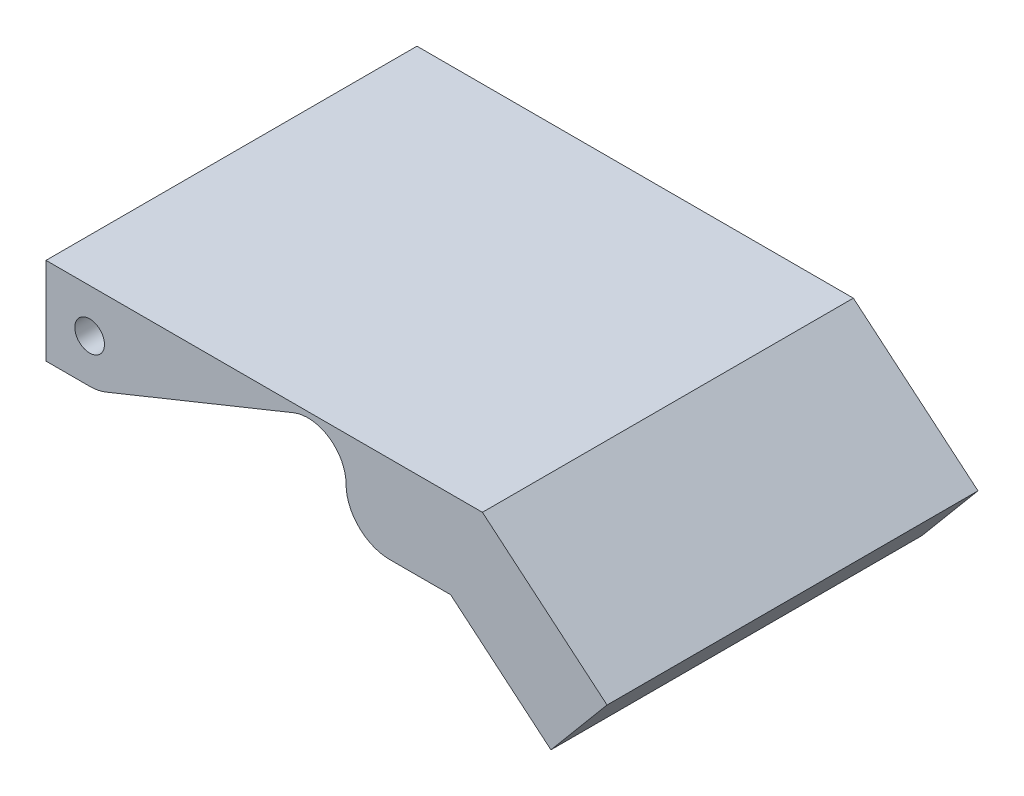
from build123d import *

# Parameters (mm, degrees)
BOSS_EXTRUDE1_DEPTH = 26.9875
SKETCH2_R           = 2.159
SKETCH2_R_2         = 1.905
CUT_EXTRUDE1_DEPTH  = 101.993512556
CUT_EXTRUDE2_DEPTH  = 12.7


with BuildPart() as part:
    # Sketch1 → Boss-Extrude1 (new, symmetric)
    with BuildSketch(Plane.XY):
        Polygon((0, 0), (63.5, 0), (81.634127309, -15.216339537), (73.470724666, -24.945103965), (58.877578025, -12.7), (0, -12.7), align=None)
    extrude(amount=BOSS_EXTRUDE1_DEPTH, both=True)

    # Sketch2 → Cut-Extrude1 (cut, through all)
    with BuildSketch(Plane.XY.offset(26.9875)):
        with Locations((6.35, -6.35)):
            Circle(SKETCH2_R)
        with Locations((38.1, -6.35)):
            Circle(SKETCH2_R_2)
    extrude(amount=-CUT_EXTRUDE1_DEPTH, mode=Mode.SUBTRACT)

    # Sketch3 → Cut-Extrude2 (cut)
    with BuildSketch(Plane.XY.offset(26.9875)):
        with BuildLine():
            Line((8.73125, -12.236607549), (36.01640625, -1.199218395))
            ThreePointArc((36.01640625, -1.199218395), (41.206038175, -1.743000877), (43.65625, -6.35))
            ThreePointArc((43.65625, -6.35), (45.516121939, -10.840128061), (50.00625, -12.7))
            Line((50.00625, -12.7), (6.35, -12.7))
            ThreePointArc((6.35, -12.7), (7.562959617, -12.583075402), (8.73125, -12.236607549))
        make_face()
    cut_extrude2 = extrude(amount=-CUT_EXTRUDE2_DEPTH, mode=Mode.SUBTRACT)

    # Mirror1: Cut-Extrude2 across plane
    add(cut_extrude2.mirror(Plane.XY), mode=Mode.SUBTRACT)


solid = part.part
